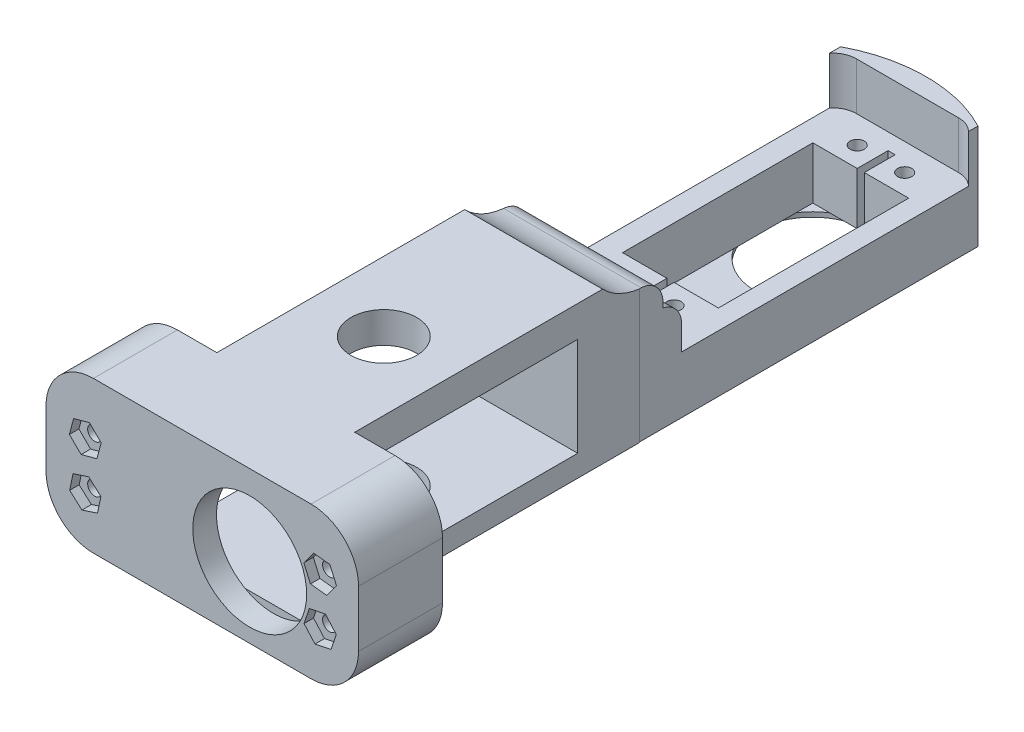
from build123d import *

# Parameters (mm, degrees)
SKETCH_1_R                = 2.15
EXTRUDE_1_DEPTH           = 12.7
SKETCH_2_R                = 12
EXTRUDE_3_DEPTH           = 5
EXTRUDE_4_DEPTH           = 50
EXTRUDE_5_DEPTH           = 60
EXTRUDE_5_DEPTH_BACK      = 5
EXTRUDE_6_DEPTH           = 66
CUT_EXTRUDE_START         = -102
SKETCH_6_W                = 75.802873712
SKETCH_6_H                = 45.33405629
CUT_EXTRUDE_2_DEPTH       = 102
EXTRUDE_7_DEPTH           = 33
SKETCH_9_R                = 2.02
SKETCH_9_W                = 1.5
SKETCH_9_H                = 6.5
CUT_EXTRUDE_4_DEPTH       = 27
CUT_EXTRUDE_5_DEPTH       = 16
CUT_EXTRUDE_7_DEPTH       = 6
SKETCH_13_R               = 12
CUT_EXTRUDE_8_DEPTH       = 80
CUT_EXTRUDE_START_2       = -146
SKETCH_14_W               = 72.258843252
SKETCH_14_H               = 48.14078226
CUT_EXTRUDE_9_DEPTH       = 146
SKETCH_18_R               = 2.15
SKETCH_18_R_2             = 1.5
EXTRUDE_8_DEPTH           = 14
SKETCH_19_R               = 1.5
CUT_EXTRUDE_14_DEPTH      = 25
CUT_EXTRUDE_17_DEPTH      = 39
CUT_EXTRUDE_22_DEPTH      = 102
SKETCH_25_W               = 2
SKETCH_25_H               = 20.8
CUT_EXTRUDE_23_DEPTH      = 102
CUT_EXTRUDE_27_DEPTH      = 102
CUT_EXTRUDE_27_DEPTH_BACK = 102
SKETCH_26_W               = 155.773085546
SKETCH_26_H               = 1.999983639
SKETCH_27_R               = 2.02
SKETCH_27_R_2             = 1.5
EXTRUDE_9_DEPTH           = 15
SKETCH_28_R               = 1.5
CUT_EXTRUDE_30_DEPTH      = 22
CUT_EXTRUDE_31_DEPTH      = 58
CUT_EXTRUDE_31_DEPTH_BACK = 58
SKETCH_29_W               = 173.924957372
SKETCH_29_H               = 22.648128706
SKETCH_31_R               = 6.927691279
CUT_EXTRUDE_32_DEPTH      = 58
CUT_EXTRUDE_33_DEPTH      = 2
CUT_EXTRUDE_34_DEPTH      = 2
SKETCH_34_W               = 32.144660531
SKETCH_34_H               = 60.450390851
SKETCH_34_W_2             = 30.541996443
SKETCH_34_H_2             = 60.033306036
CUT_EXTRUDE_35_DEPTH      = 69
CUT_EXTRUDE_36_DEPTH      = 69
CUT_EXTRUDE_36_DEPTH_BACK = 69
SKETCH_35_W               = 79.180596306
SKETCH_35_H               = 6.874595506
FILLET_1_R                = 10
FILLET_3_R                = 5


with BuildPart() as part:
    # 草图1 → 凸台-拉伸1 (new body)
    with BuildSketch(Plane.XY):
        with BuildLine():
            Line((-30, 20), (30, 20))
            ThreePointArc((30, 20), (32.121320344, 19.121320344), (33, 17))
            Line((33, 17), (33, -17))
            ThreePointArc((33, -17), (32.121320344, -19.121320344), (30, -20))
            Line((30, -20), (-30, -20))
            ThreePointArc((-30, -20), (-32.121320344, -19.121320344), (-33, -17))
            Line((-33, -17), (-33, 17))
            ThreePointArc((-33, 17), (-32.121320344, 19.121320344), (-30, 20))
        make_face()
        with Locations((-24.65, 5.088271937)):
            Circle(SKETCH_1_R, mode=Mode.SUBTRACT)
        with Locations((-24.65, -4.911728063)):
            Circle(SKETCH_1_R, mode=Mode.SUBTRACT)
        with Locations((24.85, 5.088271937)):
            Circle(SKETCH_1_R, mode=Mode.SUBTRACT)
        with Locations((24.85, -4.911728063)):
            Circle(SKETCH_1_R, mode=Mode.SUBTRACT)
        Polygon((-20.4, -0.75), (-20.4, -10.4), (20.4, -10.4), (20.4, -0.75), (28.385604955, -0.75), (28.385604955, 0.75), (20.4, 0.75), (20.4, 10.4), (-20.4, 10.4), (-20.4, 0.75), (-28.718235043, 0.75), (-28.718235043, -0.75), align=None, mode=Mode.SUBTRACT)
    extrude(amount=EXTRUDE_1_DEPTH)

    # 草图2 → 凸台-拉伸3 (add)
    with BuildSketch(Plane.XY.offset(12.7)):
        with BuildLine():
            Line((-29.929949684, 19.939802064), (29.929949684, 19.939802064))
            ThreePointArc((29.929949684, 19.939802064), (32.051270027, 19.061122408), (32.929949684, 16.939802064))
            Line((32.929949684, 16.939802064), (32.929949684, -16.939802064))
            ThreePointArc((32.929949684, -16.939802064), (32.051270027, -19.061122408), (29.929949684, -19.939802064))
            Line((29.929949684, -19.939802064), (-29.929949684, -19.939802064))
            ThreePointArc((-29.929949684, -19.939802064), (-32.051270027, -19.061122408), (-32.929949684, -16.939802064))
            Line((-32.929949684, -16.939802064), (-32.929949684, 16.939802064))
            ThreePointArc((-32.929949684, 16.939802064), (-32.051270027, 19.061122408), (-29.929949684, 19.939802064))
        make_face()
        with Locations(Location((10, 0, 0), (0, 0, 119.926434867))):
            Circle(SKETCH_2_R, mode=Mode.SUBTRACT)
    extrude(amount=EXTRUDE_3_DEPTH)

    # 草图3 → 凸台-拉伸4 (add)
    with BuildSketch(Plane(origin=(0, 0, 0), x_dir=(-1, 0, 0), z_dir=(0, 0, -1))):
        with BuildLine():
            Line((30, 19.959782656), (-30, 19.959782656))
            ThreePointArc((-30, 19.959782656), (-32.121320344, 19.081102999), (-33, 16.959782656))
            Line((-33, 16.959782656), (-33, 10.2))
            Line((-33, 10.2), (-20.4, 10.2))
            Line((-20.4, 10.2), (-20.4, 10.4))
            Line((-20.4, 10.4), (20.4, 10.4))
            Line((20.4, 10.4), (20.4, 10.2))
            Line((20.4, 10.2), (33, 10.2))
            Line((33, 10.2), (33, 16.959782656))
            ThreePointArc((33, 16.959782656), (32.121320344, 19.081102999), (30, 19.959782656))
        make_face()
        with BuildLine():
            Line((-20.4, -10.2), (-33, -10.2))
            Line((-33, -10.2), (-33, -16.959782656))
            ThreePointArc((-33, -16.959782656), (-32.121320344, -19.081102999), (-30, -19.959782656))
            Line((-30, -19.959782656), (30, -19.959782656))
            ThreePointArc((30, -19.959782656), (32.121320344, -19.081102999), (33, -16.959782656))
            Line((33, -16.959782656), (33, -10.2))
            Line((33, -10.2), (20.4, -10.2))
            Line((20.4, -10.2), (20.4, -10.4))
            Line((20.4, -10.4), (-20.4, -10.4))
            Line((-20.4, -10.4), (-20.4, -10.2))
        make_face()
    extrude(amount=EXTRUDE_4_DEPTH)

    # 草图4 → 凸台-拉伸5 (add, two sides: drawn at the far end of the back side and taken through both)
    with BuildSketch(Plane(origin=(0, 0, -50), x_dir=(-1, 0, 0), z_dir=(0, 0, -1)).offset(-EXTRUDE_5_DEPTH_BACK)):
        with BuildLine():
            Line((-20.4, 10.2), (-33, 10.2))
            Line((-33, 10.2), (-33, -16.959782656))
            ThreePointArc((-33, -16.959782656), (-32.121320344, -19.081102999), (-30, -19.959782656))
            Line((-30, -19.959782656), (30, -19.959782656))
            ThreePointArc((30, -19.959782656), (32.121320344, -19.081102999), (33, -16.959782656))
            Line((33, -16.959782656), (33, 10.2))
            Line((33, 10.2), (20.4, 10.2))
            Line((20.4, 10.2), (20.4, 10.4))
            Line((20.4, 10.4), (-20.4, 10.4))
            Line((-20.4, 10.4), (-20.4, 10.2))
        make_face()
        Polygon((33, 13.040217344), (-33, 13.040217344), (-33, 10.2), (-20.4, 10.2), (-20.4, 10.4), (20.4, 10.4), (20.4, 10.2), (33, 10.2), align=None)
    extrude(amount=EXTRUDE_5_DEPTH + EXTRUDE_5_DEPTH_BACK)

    # 草图5 → 凸台-拉伸6 (add)
    with BuildSketch(Plane(origin=(33, 0, 0), x_dir=(0, 0, -1), z_dir=(1, 0, 0))):
        with BuildLine():
            add(Edge.make_bspline(
                [(50, 19.959782656), (53.467874462, 13.856262386), (60.450390851, 13.040217344)],
                knots=[0, 0, 0, 1, 1, 1], degree=2))
            Line((50, 19.959782656), (50, 13.040217344))
            Line((50, 13.040217344), (60.450390851, 13.040217344))
        make_face()
    extrude(amount=-EXTRUDE_6_DEPTH)

    # 草图6 → 切除-拉伸2 (cut)
    with BuildSketch(Plane.XY.offset(-45).offset(CUT_EXTRUDE_START)):
        Rectangle(SKETCH_6_W, SKETCH_6_H)
        with BuildLine():
            Line((-29.929949684, 19.939802064), (29.929949684, 19.939802064))
            ThreePointArc((29.929949684, 19.939802064), (32.051270027, 19.061122408), (32.929949684, 16.939802064))
            Line((32.929949684, 16.939802064), (32.929949684, -16.939802064))
            ThreePointArc((32.929949684, -16.939802064), (32.051270027, -19.061122408), (29.929949684, -19.939802064))
            Line((29.929949684, -19.939802064), (-29.929949684, -19.939802064))
            ThreePointArc((-29.929949684, -19.939802064), (-32.051270027, -19.061122408), (-32.929949684, -16.939802064))
            Line((-32.929949684, -16.939802064), (-32.929949684, 16.939802064))
            ThreePointArc((-32.929949684, 16.939802064), (-32.051270027, 19.061122408), (-29.929949684, 19.939802064))
        make_face(mode=Mode.SUBTRACT)
    extrude(amount=CUT_EXTRUDE_2_DEPTH, mode=Mode.SUBTRACT)

    # 草图8 → 凸台-拉伸7 (add)
    with BuildSketch(Plane(origin=(0, 13.040217344, 0), x_dir=(1, 0, 0), z_dir=(0, 1, 0))):
        with BuildLine():
            Line((-32.929949684, 110), (32.929949684, 110))
            ThreePointArc((32.929949684, 110), (0, 141.105335458), (-32.929949684, 110))
        make_face()
    extrude(amount=-EXTRUDE_7_DEPTH)

    # 草图9 → 切除-拉伸4 (cut)
    with BuildSketch(Plane(origin=(0, 13.040217344, 0), x_dir=(1, 0, 0), z_dir=(0, 1, 0))):
        Polygon((-0.673067712, 120.99817886), (-10.023067712, 120.99817886), (-10.023067712, 80.89817886), (-0.673067712, 80.89817886), (-0.673067712, 87.39817886), (0.826932288, 87.39817886), (0.826932288, 80.89817886), (10.176932288, 80.89817886), (10.176932288, 120.99817886), (0.826932288, 120.99817886), (0.826932288, 114.49817886), (-0.673067712, 114.49817886), align=None)
        with Locations(Location((-4.923067712, 125.24817886, 0), (0, 0, 270))):
            Circle(SKETCH_9_R)
        with Locations(Location((5.076932288, 125.24817886, 0), (0, 0, 270))):
            Circle(SKETCH_9_R)
        with Locations((0.076932288, 124.24817886)):
            Rectangle(SKETCH_9_W, SKETCH_9_H)
        with Locations((0.076932288, 117.74817886)):
            Rectangle(SKETCH_9_W, SKETCH_9_H)
        with Locations((0.076932288, 84.14817886)):
            Rectangle(SKETCH_9_W, SKETCH_9_H)
        with Locations((0.076932288, 77.64817886)):
            Rectangle(SKETCH_9_W, SKETCH_9_H)
        with Locations(Location((5.076932288, 76.64817886, 0), (0, 0, 270))):
            Circle(SKETCH_9_R)
        with Locations(Location((-4.923067712, 76.64817886, 0), (0, 0, 270))):
            Circle(SKETCH_9_R)
    extrude(amount=-CUT_EXTRUDE_4_DEPTH, mode=Mode.SUBTRACT)

    # 草图11 → 切除-拉伸5 (cut)
    with BuildSketch(Plane(origin=(0, 13.040217344, 0), x_dir=(1, 0, 0), z_dir=(0, 1, 0))):
        with BuildLine():
            Line((-10.786908342, 130.921820824), (10.786908342, 130.921820824))
            ThreePointArc((10.786908342, 130.921820824), (14.322442248, 129.45735473), (15.786908342, 125.921820824))
            Line((15.786908342, 125.921820824), (15.786908342, 68.99903474))
            Line((15.786908342, 68.99903474), (-15.786908342, 68.99903474))
            Line((-15.786908342, 68.99903474), (-15.786908342, 125.921820824))
            ThreePointArc((-15.786908342, 125.921820824), (-14.322442248, 129.45735473), (-10.786908342, 130.921820824))
        make_face()
    extrude(amount=-CUT_EXTRUDE_5_DEPTH, mode=Mode.SUBTRACT)

    # 草图12 → 切除-拉伸7 (cut)
    with BuildSketch(Plane(origin=(0, 13.040217344, 0), x_dir=(1, 0, 0), z_dir=(0, 1, 0))):
        Polygon((-15.786908342, 110.63089919), (-25.456450151, 110.63089919), (-25.456450151, 65.087124834), (25.456450151, 65.087124834), (25.456450151, 110.63089919), (15.786908342, 110.63089919), (15.786908342, 68.99903474), (-15.786908342, 68.99903474), align=None)
        with BuildLine():
            ThreePointArc((25.456450151, 110.63089919), (0, 136.087349341), (-25.456450151, 110.63089919))
            Line((-25.456450151, 110.63089919), (-15.786908342, 110.63089919))
            Line((-15.786908342, 110.63089919), (-15.786908342, 125.921820824))
            ThreePointArc((-15.786908342, 125.921820824), (-14.322442248, 129.45735473), (-10.786908342, 130.921820824))
            Line((-10.786908342, 130.921820824), (10.786908342, 130.921820824))
            ThreePointArc((10.786908342, 130.921820824), (14.322442248, 129.45735473), (15.786908342, 125.921820824))
            Line((15.786908342, 125.921820824), (15.786908342, 110.63089919))
            Line((15.786908342, 110.63089919), (25.456450151, 110.63089919))
        make_face()
    extrude(amount=-CUT_EXTRUDE_7_DEPTH, mode=Mode.SUBTRACT)

    # 草图13 → 切除-拉伸8 (cut)
    with BuildSketch(Plane(origin=(0, -13.959782656, 0), x_dir=(1, 0, 0), z_dir=(0, 1, 0))):
        with Locations(Location((0, 110.89817886, 0), (0, 0, 213.357533159))):
            Circle(SKETCH_13_R)
    extrude(amount=-CUT_EXTRUDE_8_DEPTH, mode=Mode.SUBTRACT)

    # 草图14 → 切除-拉伸9 (cut)
    with BuildSketch(Plane.XY.offset(17.7).offset(CUT_EXTRUDE_START_2)):
        Rectangle(SKETCH_14_W, SKETCH_14_H)
        with BuildLine():
            Line((-29.929949684, 19.939802064), (29.929949684, 19.939802064))
            ThreePointArc((29.929949684, 19.939802064), (32.051270027, 19.061122408), (32.929949684, 16.939802064))
            Line((32.929949684, 16.939802064), (32.929949684, -16.939802064))
            ThreePointArc((32.929949684, -16.939802064), (32.051270027, -19.061122408), (29.929949684, -19.939802064))
            Line((29.929949684, -19.939802064), (-29.929949684, -19.939802064))
            ThreePointArc((-29.929949684, -19.939802064), (-32.051270027, -19.061122408), (-32.929949684, -16.939802064))
            Line((-32.929949684, -16.939802064), (-32.929949684, 16.939802064))
            ThreePointArc((-32.929949684, 16.939802064), (-32.051270027, 19.061122408), (-29.929949684, 19.939802064))
        make_face(mode=Mode.SUBTRACT)
    extrude(amount=CUT_EXTRUDE_9_DEPTH, mode=Mode.SUBTRACT)

    # 草图18 → 凸台-拉伸8 (add)
    # profile 1 of 4: a face of its own
    with BuildSketch(Plane(origin=(0, 0, 0), x_dir=(-1, 0, 0), z_dir=(0, 0, -1))):
        with Locations((-24.85, 5.088271937)):
            Circle(SKETCH_18_R)
        with Locations((-24.85, 5.088271937)):
            Circle(SKETCH_18_R_2, mode=Mode.SUBTRACT)
    # profile 2 of 4: a face of its own
    with BuildSketch(Plane(origin=(0, 0, 0), x_dir=(-1, 0, 0), z_dir=(0, 0, -1))):
        with Locations((-24.85, -4.911728063)):
            Circle(SKETCH_18_R)
        with Locations((-24.85, -4.911728063)):
            Circle(SKETCH_18_R_2, mode=Mode.SUBTRACT)
    # profile 3 of 4: a face of its own
    with BuildSketch(Plane(origin=(0, 0, 0), x_dir=(-1, 0, 0), z_dir=(0, 0, -1))):
        with Locations((24.65, 5.088271937)):
            Circle(SKETCH_18_R)
        with Locations((24.65, 5.088271937)):
            Circle(SKETCH_18_R_2, mode=Mode.SUBTRACT)
    # profile 4 of 4: a face of its own
    with BuildSketch(Plane(origin=(0, 0, 0), x_dir=(-1, 0, 0), z_dir=(0, 0, -1))):
        with Locations((24.65, -4.911728063)):
            Circle(SKETCH_18_R)
        with Locations((24.65, -4.911728063)):
            Circle(SKETCH_18_R_2, mode=Mode.SUBTRACT)
    extrude(amount=-EXTRUDE_8_DEPTH)

    # 草图19 → 切除-拉伸14 (cut)
    with BuildSketch(Plane(origin=(0, 0, 0), x_dir=(-1, 0, 0), z_dir=(0, 0, -1))):
        with Locations((-24.85, 5.088271937)):
            Circle(SKETCH_19_R)
        with Locations((-24.85, -4.911728063)):
            Circle(SKETCH_19_R)
        with Locations((24.65, 5.088271937)):
            Circle(SKETCH_19_R)
        with Locations((24.65, -4.911728063)):
            Circle(SKETCH_19_R)
    extrude(amount=-CUT_EXTRUDE_14_DEPTH, mode=Mode.SUBTRACT)

    # 草图21 → 切除-拉伸17 (cut)
    with BuildSketch(Plane(origin=(0, 13.040217344, 0), x_dir=(1, 0, 0), z_dir=(0, 1, 0))):
        with BuildLine():
            Line((-32.929949684, 60.450390851), (-14.629633558, 60.450390851))
            Line((-14.629633558, 60.450390851), (-14.629633558, 65.087124834))
            Line((-14.629633558, 65.087124834), (-25.456450151, 65.087124834))
            Line((-25.456450151, 65.087124834), (-25.456450151, 110.63089919))
            ThreePointArc((-25.456450151, 110.63089919), (-22.588153883, 122.369985971), (-14.629633558, 131.46367808))
            ThreePointArc((-14.629633558, 131.46367808), (11.739086781, 133.219053073), (25.456450151, 110.63089919))
            Line((25.456450151, 110.63089919), (25.456450151, 65.087124834))
            Line((25.456450151, 65.087124834), (14.319266208, 65.087124834))
            Line((14.319266208, 65.087124834), (14.319266208, 60.450390851))
            Line((14.319266208, 60.450390851), (32.929949684, 60.450390851))
            Line((32.929949684, 60.450390851), (32.929949684, 110))
            ThreePointArc((32.929949684, 110), (0, 141.105335458), (-32.929949684, 110))
            Line((-32.929949684, 110), (-32.929949684, 60.450390851))
        make_face()
        with BuildLine():
            Line((-25.456450151, 65.087124834), (-14.629633558, 65.087124834))
            Line((-14.629633558, 65.087124834), (-14.629633558, 131.46367808))
            ThreePointArc((-14.629633558, 131.46367808), (-22.588153883, 122.369985971), (-25.456450151, 110.63089919))
            Line((-25.456450151, 110.63089919), (-25.456450151, 65.087124834))
        make_face()
        with BuildLine():
            Line((39.212280638, 142.52991184), (-41.776160526, 142.52991184))
            Line((-41.776160526, 142.52991184), (-41.776160526, 60.033306036))
            Line((-41.776160526, 60.033306036), (-14.629633558, 60.033306036))
            Line((-14.629633558, 60.033306036), (-14.629633558, 60.450390851))
            Line((-14.629633558, 60.450390851), (-32.929949684, 60.450390851))
            Line((-32.929949684, 60.450390851), (-32.929949684, 110))
            ThreePointArc((-32.929949684, 110), (0, 141.105335458), (32.929949684, 110))
            Line((32.929949684, 110), (32.929949684, 60.450390851))
            Line((32.929949684, 60.450390851), (14.319266208, 60.450390851))
            Line((14.319266208, 60.450390851), (14.319266208, 60.033306036))
            Line((14.319266208, 60.033306036), (39.212280638, 60.033306036))
            Line((39.212280638, 60.033306036), (39.212280638, 142.52991184))
        make_face()
        with BuildLine():
            Line((14.319266208, 131.46367808), (14.319266208, 65.087124834))
            Line((14.319266208, 65.087124834), (25.456450151, 65.087124834))
            Line((25.456450151, 65.087124834), (25.456450151, 110.63089919))
            ThreePointArc((25.456450151, 110.63089919), (11.739086781, 133.219053073), (-14.629633558, 131.46367808))
            ThreePointArc((-14.629633558, 131.46367808), (-0.155183675, 135.019992714), (14.319266208, 131.46367808))
        make_face()
    extrude(amount=-CUT_EXTRUDE_17_DEPTH, mode=Mode.SUBTRACT)

    # 草图24 → 切除-拉伸22 (cut)
    with BuildSketch(Plane(origin=(0, 19.939802064, 0), x_dir=(1, 0, 0), z_dir=(0, 1, 0))):
        Polygon((-14.629633558, 60.450390851), (-29.929949684, 0), (-48.056642762, 0), (-48.056642762, 60.450390851), align=None)
        Polygon((14.319266208, 60.450390851), (58.354494782, 60.450390851), (58.354494782, 0), (29.929949684, 0), align=None)
    extrude(amount=-CUT_EXTRUDE_22_DEPTH, mode=Mode.SUBTRACT)

    # 草图25 → 切除-拉伸23 (cut)
    with BuildSketch(Plane.ZY.offset(32.929949684)):
        with Locations((-46, 0)):
            Rectangle(SKETCH_25_W, SKETCH_25_H)
    extrude(amount=-CUT_EXTRUDE_23_DEPTH, mode=Mode.SUBTRACT)

    # 草图26 → 切除-拉伸27 (cut, two sides: drawn at the far end of the back side and taken through both)
    with BuildSketch(Plane.ZY.offset(14.629633558).offset(-CUT_EXTRUDE_27_DEPTH_BACK)):
        with Locations((-57.133449941, -18.959790837)):
            Rectangle(SKETCH_26_W, SKETCH_26_H)
    extrude(amount=CUT_EXTRUDE_27_DEPTH + CUT_EXTRUDE_27_DEPTH_BACK, mode=Mode.SUBTRACT)

    # 草图27 → 凸台-拉伸9 (add)
    # profile 1 of 4: a face of its own
    with BuildSketch(Plane(origin=(0, -2.959782656, 0), x_dir=(1, 0, 0), z_dir=(0, 1, 0))):
        with Locations((-4.923067712, 125.24817886)):
            Circle(SKETCH_27_R)
        with Locations(Location((-4.923067712, 125.24817886, 0), (0, 0, 270))):
            Circle(SKETCH_27_R_2, mode=Mode.SUBTRACT)
    # profile 2 of 4: a face of its own
    with BuildSketch(Plane(origin=(0, -2.959782656, 0), x_dir=(1, 0, 0), z_dir=(0, 1, 0))):
        with Locations((5.076932288, 125.24817886)):
            Circle(SKETCH_27_R)
        with Locations(Location((5.076932288, 125.24817886, 0), (0, 0, 270))):
            Circle(SKETCH_27_R_2, mode=Mode.SUBTRACT)
    # profile 3 of 4: a face of its own
    with BuildSketch(Plane(origin=(0, -2.959782656, 0), x_dir=(1, 0, 0), z_dir=(0, 1, 0))):
        with Locations((5.076932288, 76.64817886)):
            Circle(SKETCH_27_R)
        with Locations(Location((5.076932288, 76.64817886, 0), (0, 0, 270))):
            Circle(SKETCH_27_R_2, mode=Mode.SUBTRACT)
    # profile 4 of 4: a face of its own
    with BuildSketch(Plane(origin=(0, -2.959782656, 0), x_dir=(1, 0, 0), z_dir=(0, 1, 0))):
        with Locations((-4.923067712, 76.64817886)):
            Circle(SKETCH_27_R)
        with Locations(Location((-4.923067712, 76.64817886, 0), (0, 0, 270))):
            Circle(SKETCH_27_R_2, mode=Mode.SUBTRACT)
    extrude(amount=-EXTRUDE_9_DEPTH)

    # 草图28 → 切除-拉伸30 (cut)
    with BuildSketch(Plane(origin=(0, -2.959782656, 0), x_dir=(1, 0, 0), z_dir=(0, 1, 0))):
        with Locations(Location((-4.923067712, 125.24817886, 0), (0, 0, 270))):
            Circle(SKETCH_28_R)
        with Locations(Location((5.076932288, 125.24817886, 0), (0, 0, 270))):
            Circle(SKETCH_28_R)
        with Locations(Location((5.076932288, 76.64817886, 0), (0, 0, 270))):
            Circle(SKETCH_28_R)
        with Locations(Location((-4.923067712, 76.64817886, 0), (0, 0, 270))):
            Circle(SKETCH_28_R)
    extrude(amount=-CUT_EXTRUDE_30_DEPTH, mode=Mode.SUBTRACT)

    # 草图29 → 切除-拉伸31 (cut, two sides: drawn at the far end of the back side and taken through both)
    with BuildSketch(Plane(origin=(14.319266208, 0, 0), x_dir=(0, 0, -1), z_dir=(1, 0, 0)).offset(-CUT_EXTRUDE_31_DEPTH_BACK)):
        with Locations((56.781869275, -26.28386337)):
            Rectangle(SKETCH_29_W, SKETCH_29_H)
    extrude(amount=CUT_EXTRUDE_31_DEPTH + CUT_EXTRUDE_31_DEPTH_BACK, mode=Mode.SUBTRACT)

    # 草图31 → 切除-拉伸32 (cut)
    with BuildSketch(Plane(origin=(0, 19.939802064, 0), x_dir=(1, 0, 0), z_dir=(0, 1, 0))):
        with Locations(Location((0, 20.557694321, 0), (0, 0, 270))):
            Circle(SKETCH_31_R)
    extrude(amount=-CUT_EXTRUDE_32_DEPTH, mode=Mode.SUBTRACT)

    # 草图32 → 切除-拉伸33 (cut)
    with BuildSketch(Plane.XZ.offset(14.959799017)):
        Polygon((-2.63333609, -79.247626706), (-1.527014031, -75.964937031), (-3.816745652, -73.365489185), (-7.212799333, -74.048731014), (-8.319121392, -77.331420689), (-6.029389771, -79.930868535), align=None)
        Polygon((7.078684737, -79.475366002), (8.526224399, -76.328203958), (6.52447195, -73.501016816), (3.07517984, -73.820991718), (1.627640178, -76.968153762), (3.629392627, -79.795340903), align=None)
        Polygon((-2.181235598, -123.131021175), (-5.385663993, -121.815103754), (-8.127496107, -123.932261439), (-7.664899825, -127.365336544), (-4.46047143, -128.681253965), (-1.718639316, -126.564096281), align=None)
        Polygon((7.863971743, -127.30546131), (8.25211088, -123.863173116), (5.465071425, -121.805890666), (2.289892834, -123.19089641), (1.901753697, -126.633184604), (4.688793151, -128.690467054), align=None)
    extrude(amount=-CUT_EXTRUDE_33_DEPTH, mode=Mode.SUBTRACT)

    # 草图33 → 切除-拉伸34 (cut)
    with BuildSketch(Plane.XY.offset(17.7)):
        Polygon((-22.193532135, 2.645780253), (-21.30650622, 5.99438967), (-23.762974086, 8.436881354), (-27.106467865, 7.530763621), (-27.99349378, 4.182154204), (-25.537025914, 1.73966252), align=None)
        Polygon((-22.069388374, -7.222668052), (-21.358361449, -3.832322832), (-23.938973076, -1.521382842), (-27.230611626, -2.600788073), (-27.941638551, -5.991133294), (-25.361026924, -8.302073283), align=None)
        Polygon((26.242460111, 1.916355349), (28.293190399, 4.708219473), (26.900730288, 7.880136061), (23.457539889, 8.260188525), (21.406809601, 5.468324401), (22.799269712, 2.296407814), align=None)
        Polygon((27.149269382, -7.502743367), (28.243519766, -4.21601002), (25.944250384, -1.624994715), (22.550730618, -2.320712758), (21.456480234, -5.607446106), (23.755749616, -8.19846141), align=None)
    extrude(amount=-CUT_EXTRUDE_34_DEPTH, mode=Mode.SUBTRACT)

    # 草图34 → 切除-拉伸35 (cut)
    with BuildSketch(Plane(origin=(0, 19.939802064, 0), x_dir=(1, 0, 0), z_dir=(0, 1, 0))):
        with Locations((-30.701963824, 30.225195426)):
            Rectangle(SKETCH_34_W, SKETCH_34_H)
        with Locations((29.697972237, 30.016653018)):
            Rectangle(SKETCH_34_W_2, SKETCH_34_H_2)
    extrude(amount=-CUT_EXTRUDE_35_DEPTH, mode=Mode.SUBTRACT)

    # 草图35 → 切除-拉伸36 (cut, two sides: drawn at the far end of the back side and taken through both)
    with BuildSketch(Plane(origin=(14.426974015, 0, 0), x_dir=(0, 0, -1), z_dir=(1, 0, 0)).offset(-CUT_EXTRUDE_36_DEPTH_BACK)):
        with Locations((21.890298153, 20.377099817)):
            Rectangle(SKETCH_35_W, SKETCH_35_H)
    extrude(amount=CUT_EXTRUDE_36_DEPTH + CUT_EXTRUDE_36_DEPTH_BACK, mode=Mode.SUBTRACT)

    # 圆角1
    fillet_1_edges = [part.edges().sort_by_distance(p)[0] for p in [
        (32.929949684, -14.959799017, 8.85),
        (-32.929949684, -14.959799017, 8.85),
        (-32.929949684, 16.939802064, 8.85),
        (32.929949684, 16.939802064, 8.85),
    ]]
    fillet(fillet_1_edges, radius=FILLET_1_R)

    # 圆角3
    # the kernel refuses this fillet: 5 mm, written as the material it takes off along each edge
    with BuildSketch(Plane(origin=(-27.096599358, 13.040217344, -65.087124834), x_dir=(0, -1, 0), z_dir=(1, 0, 0))) as fillet_3_piece_1:
        with BuildLine():
            CenterArc((4.98678632, -5), FILLET_3_R, 90, 85.833607213)
            Line((0, -4.636733984), (-0.099735726, -4.629468663))
            ThreePointArc((-0.099735726, -4.629468663), (-0.1, -2.318366992), (-0.1, 0))
            Line((-0.1, 0), (0, 0.1))
            Line((0, 0.1), (4.98678632, 0.1))
            Line((4.98678632, 0.1), (4.98678632, 0))
        make_face()
    extrude(amount=53.882831366, mode=Mode.SUBTRACT)
    with BuildSketch(Plane(origin=(26.519691392, 7.040217344, -68.99903474), x_dir=(0, -1, 0), z_dir=(-1, 0, 0))) as fillet_3_piece_2:
        with BuildLine():
            CenterArc((4.880170073, 5), FILLET_3_R, 192.569166201, 77.430833799)
            Line((0, 3.911909905), (-0.097603401, 3.890148103))
            ThreePointArc((-0.097603401, 3.890148103), (-0.1, 1.955954953), (-0.1, 0))
            Line((-0.1, 0), (0, -0.1))
            Line((0, -0.1), (4.880170073, -0.1))
            Line((4.880170073, -0.1), (4.880170073, 0))
        make_face()
    extrude(amount=53.349750133, mode=Mode.SUBTRACT)


solid = part.part
